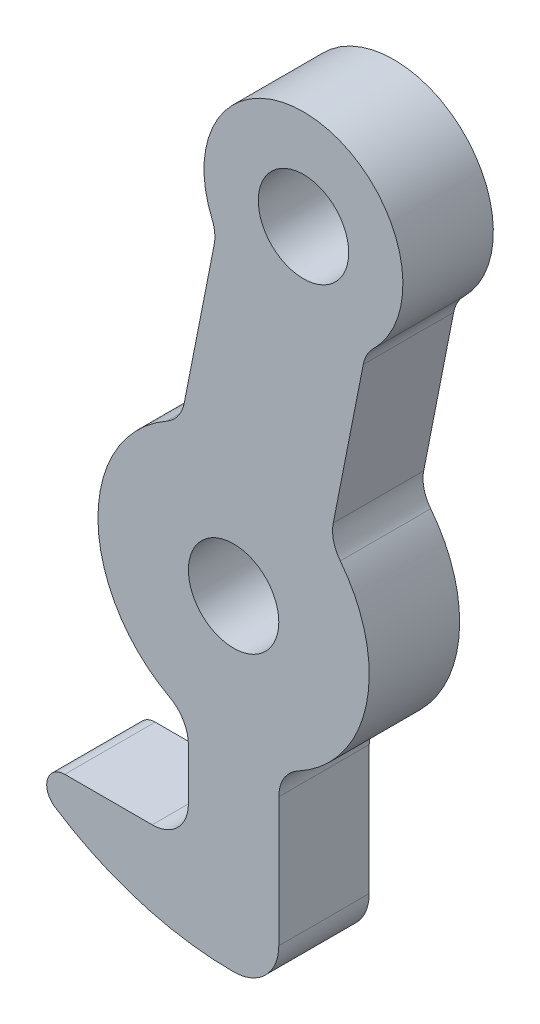
from build123d import *

# Parameters (mm, degrees)
SKETCH1_R           = 3.175
BOSS_EXTRUDE1_DEPTH = 3.175
FILLET1_R           = 2.54
FILLET2_R           = 1.27


with BuildPart() as part:
    # Sketch1 → Boss-Extrude1 (new, symmetric)
    with BuildSketch(Plane.XY):
        with BuildLine():
            Line((6.758267486, 6.712037365), (9.269907209, 19.465844568))
            ThreePointArc((9.269907209, 19.465844568), (6.257474663, 31.774710634), (-1.197056293, 21.52713034))
            Line((-1.197056293, 21.52713034), (-3.708696017, 8.773323136))
            ThreePointArc((-3.708696017, 8.773323136), (-9.520699125, -0.286204778), (-3.175, -8.980256121))
            Line((-3.175, -8.980256121), (-3.175, -16.773611102))
            Line((-3.175, -16.773611102), (-15.531438137, -16.773611102))
            ThreePointArc((-15.531438137, -16.773611102), (-8.340708909, -21.284082665), (0, -22.86))
            ThreePointArc((0, -22.86), (2.24506403, -21.93006403), (3.175, -19.685))
            Line((3.175, -19.685), (3.175, -8.980256121))
            ThreePointArc((3.175, -8.980256121), (9.285982417, -2.120414004), (6.758267486, 6.712037365))
        make_face()
        with Locations((4.907823265, 24.921341673)):
            Circle(SKETCH1_R, mode=Mode.SUBTRACT)
        Circle(SKETCH1_R, mode=Mode.SUBTRACT)
    extrude(amount=BOSS_EXTRUDE1_DEPTH, both=True)

    # Fillet1
    fillet1_edges = [part.edges().sort_by_distance(p)[0] for p in [
        (9.269907209, 19.465844568, 0),
        (-1.197056293, 21.52713034, 0),
        (-3.708696017, 8.773323136, 0),
        (6.758267486, 6.712037365, 0),
        (3.175, -8.980256121, 0),
        (-3.175, -8.980256121, 0),
        (-3.175, -16.773611102, 0),
    ]]
    fillet(fillet1_edges, radius=FILLET1_R)

    # Fillet2
    fillet2_edges = [part.edges().sort_by_distance(p)[0] for p in [
        (-15.531438137, -16.773611102, 0),
    ]]
    fillet(fillet2_edges, radius=FILLET2_R)


solid = part.part
